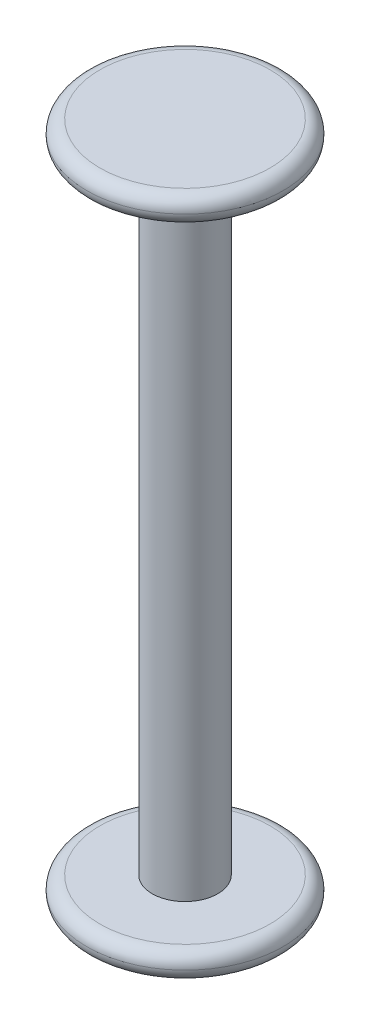
from build123d import *

# Parameters (mm, degrees)
SKETCH1_R           = 2.5
BOSS_EXTRUDE1_DEPTH = 24
SKETCH2_R           = 7.5
BOSS_EXTRUDE2_DEPTH = 2
FILLET1_R           = 1


with BuildPart() as part:
    # Sketch1 → Boss-Extrude1 (new body)
    with BuildSketch(Plane(origin=(0, 0, 0), x_dir=(1, 0, 0), z_dir=(0, 1, 0))):
        with Locations(Location((0, 0, 0), (0, 0, 270))):
            Circle(SKETCH1_R)
    extrude(amount=BOSS_EXTRUDE1_DEPTH)

    # Sketch2 → Boss-Extrude2 (add)
    with BuildSketch(Plane(origin=(0, 24, 0), x_dir=(1, 0, 0), z_dir=(0, 1, 0))):
        with Locations(Location((0, 0, 0), (0, 0, 270))):
            Circle(SKETCH2_R)
    extrude(amount=BOSS_EXTRUDE2_DEPTH)

    # Fillet1
    fillet1_edges = [part.edges().sort_by_distance(p)[0] for p in [
        (0, 24, -7.5),
        (0, 26, -7.5),
    ]]
    fillet(fillet1_edges, radius=FILLET1_R - 0.0001)  # a hair under: the kernel refuses the full size

    # Mirror1: part across plane


with BuildPart() as part_1:
    add(part.part)
    add(part.part.mirror(Plane.ZX))


solid = part_1.part
